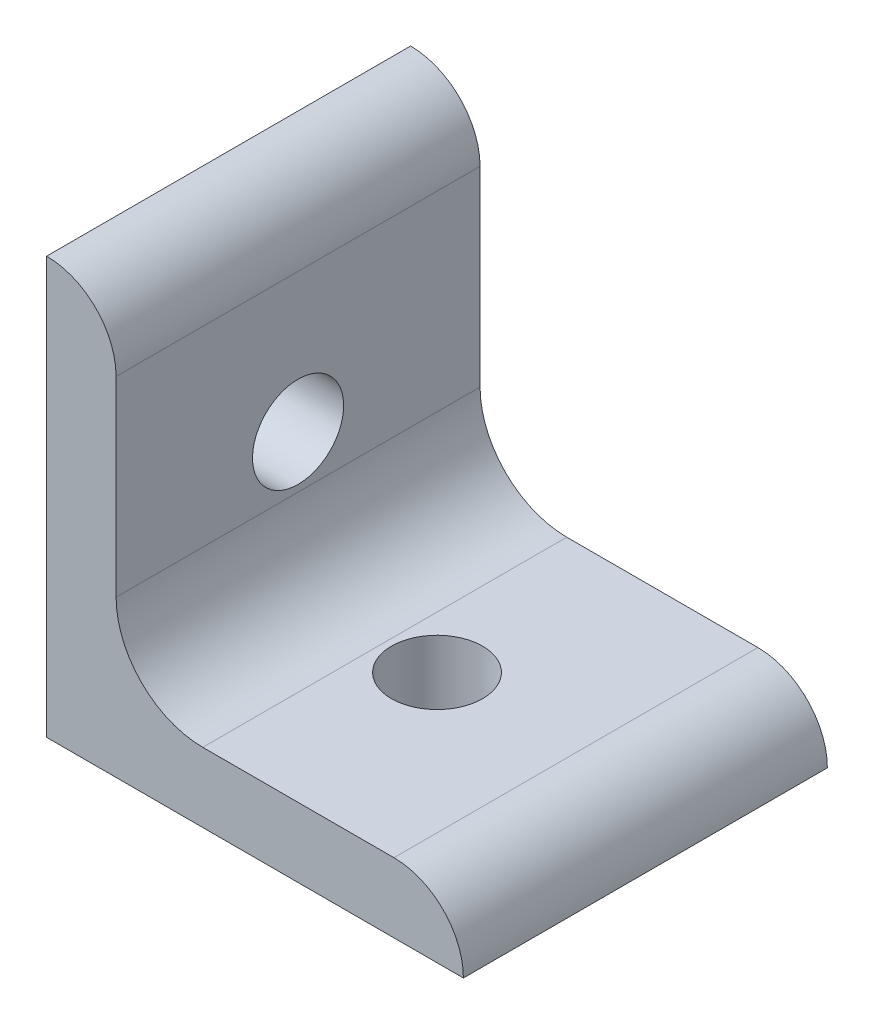
from build123d import *

# Parameters (mm, degrees)
BOSS_EXTRUDE1_DEPTH = 16.637
FILLET1_R           = 6.35
CUT_EXTRUDE1_REACH  = 58.392
SKETCH4_R           = 4.1656
CUT_EXTRUDE2_REACH  = 58.392
SKETCH5_R           = 4.1656


with BuildPart() as part:
    # Sketch2 → Boss-Extrude1 (new, symmetric)
    with BuildSketch(Plane.XY):
        with BuildLine():
            Line((0, 0), (0, 38.1))
            Line((0, 38.1), (6.35, 38.1))
            Line((6.35, 38.1), (6.35, 14.2748))
            ThreePointArc((6.35, 14.2748), (8.67112018, 8.67112018), (14.2748, 6.35))
            Line((14.2748, 6.35), (38.1, 6.35))
            Line((38.1, 6.35), (38.1, 0))
            Line((38.1, 0), (0, 0))
        make_face()
    extrude(amount=BOSS_EXTRUDE1_DEPTH, both=True)

    # Fillet1
    fillet1_edges = [part.edges().sort_by_distance(p)[0] for p in [
        (38.1, 6.35, 0),
        (6.35, 38.1, 0),
    ]]
    fillet(fillet1_edges, radius=FILLET1_R - 0.0001)  # a hair under: the kernel refuses the full size

    # Sketch4 → Cut-Extrude1 (cut, up to next)
    with BuildSketch(Plane.XZ, mode=Mode.PRIVATE) as cut_extrude1_sk1:
        with Locations((19.05, 0)):
            Circle(SKETCH4_R)
    cut_extrude1_tool1 = extrude(cut_extrude1_sk1.sketch, amount=-CUT_EXTRUDE1_REACH, mode=Mode.PRIVATE) & part.part
    add(cut_extrude1_tool1.solids().sort_by_distance((19.05, 0, 0))[0], mode=Mode.SUBTRACT)

    # Sketch5 → Cut-Extrude2 (cut, up to next)
    with BuildSketch(Plane.ZY, mode=Mode.PRIVATE) as cut_extrude2_sk1:
        with Locations(Location((0, 19.05, 0), (0, 0, 270))):
            Circle(SKETCH5_R)
    cut_extrude2_tool1 = extrude(cut_extrude2_sk1.sketch, amount=-CUT_EXTRUDE2_REACH, mode=Mode.PRIVATE) & part.part
    add(cut_extrude2_tool1.solids().sort_by_distance((0, 19.05, 0))[0], mode=Mode.SUBTRACT)


solid = part.part
